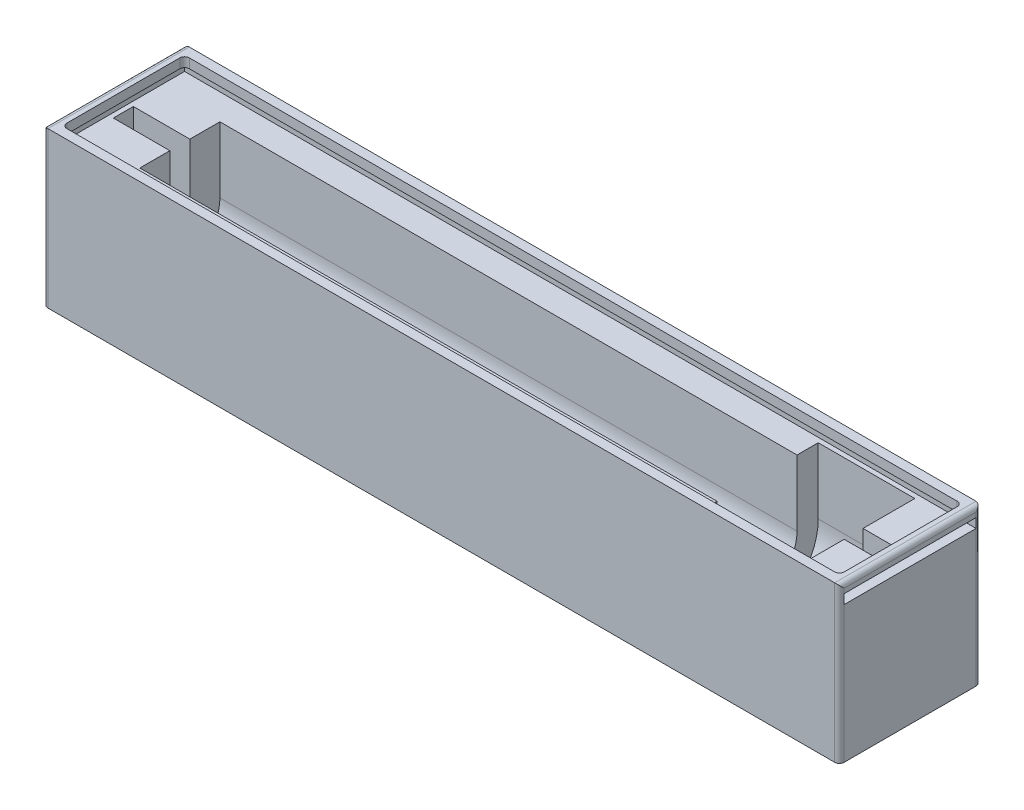
from build123d import *

# Parameters (mm, degrees)
BOSS_EXTRUDE1_DEPTH = 165
SKETCH3_W           = 30
SKETCH3_H           = 32
BOSS_EXTRUDE2_DEPTH = 2
SKETCH4_W           = 30
SKETCH4_H           = 32
BOSS_EXTRUDE3_DEPTH = 2
BOSS_EXTRUDE4_START = 10
BOSS_EXTRUDE4_DEPTH = 10
CUT_EXTRUDE1_DEPTH  = 10
BOSS_EXTRUDE6_DEPTH = 15
CUT_EXTRUDE2_DEPTH  = 15
BOSS_EXTRUDE7_DEPTH = 121
CUT_EXTRUDE3_DEPTH  = 121
SKETCH13_W          = 169
SKETCH13_H          = 30
CUT_EXTRUDE5_DEPTH  = 3
SKETCH14_W          = 169
SKETCH14_H          = 30
BOSS_EXTRUDE8_DEPTH = 3
SKETCH12_W          = 28
SKETCH12_H          = 2
CUT_EXTRUDE6_DEPTH  = 168
SKETCH16_W          = 165
SKETCH16_H          = 26
CUT_EXTRUDE7_DEPTH  = 3
CUT_EXTRUDE8_DEPTH  = 1.5
CUT_EXTRUDE9_DEPTH  = 3
SKETCH20_W          = 169
SKETCH20_H          = 30
BOSS_EXTRUDE9_DEPTH = 1
SKETCH21_W          = 165
SKETCH21_H          = 26
CUT_EXTRUDE10_DEPTH = 1
FILLET1_START       = -16
FILLET1_DEPTH       = 35
FILLET1_2_DEPTH     = 32
FILLET2_R           = 1
CUT_EXTRUDE11_DEPTH = 12


with BuildPart() as part:
    # Sketch2 → Boss-Extrude1 (new body)
    with BuildSketch(Plane(origin=(0, 0, 0), x_dir=(0, 0, -1), z_dir=(1, 0, 0))):
        with BuildLine():
            Line((-13, 0), (-13, 17))
            Line((-13, 17), (-15, 17))
            Line((-15, 17), (-15, -15))
            Line((-15, -15), (15, -15))
            Line((15, -15), (15, 17))
            Line((15, 17), (13, 17))
            Line((13, 17), (13, 0))
            ThreePointArc((13, 0), (0, -13), (-13, 0))
        make_face()
    extrude(amount=BOSS_EXTRUDE1_DEPTH)

    # Sketch3 → Boss-Extrude2 (add)
    with BuildSketch(Plane(origin=(165, 0, 0), x_dir=(0, 0, -1), z_dir=(1, 0, 0))):
        with Locations((0, 1)):
            Rectangle(SKETCH3_W, SKETCH3_H)
    extrude(amount=BOSS_EXTRUDE2_DEPTH)

    # Sketch4 → Boss-Extrude3 (add)
    with BuildSketch(Plane.ZY):
        with Locations((0, 1)):
            Rectangle(SKETCH4_W, SKETCH4_H)
    extrude(amount=BOSS_EXTRUDE3_DEPTH)

    # Sketch5 → Boss-Extrude4 (add)
    with BuildSketch(Plane.ZY.offset(-165).offset(BOSS_EXTRUDE4_START)):
        with BuildLine():
            Line((-13, 17), (-13, 0))
            ThreePointArc((-13, 0), (0, -13), (13, 0))
            Line((13, 0), (13, 17))
            Line((13, 17), (-13, 17))
        make_face()
    extrude(amount=-BOSS_EXTRUDE4_DEPTH)

    # Sketch6 → Cut-Extrude1 (cut)
    with BuildSketch(Plane.ZY.offset(-155)):
        with BuildLine():
            Line((-2, 0), (-2, 17))
            Line((-2, 17), (2, 17))
            Line((2, 17), (2, 0))
            ThreePointArc((2, 0), (0, -2), (-2, 0))
        make_face()
    extrude(amount=-CUT_EXTRUDE1_DEPTH, mode=Mode.SUBTRACT)

    # Sketch8 → Boss-Extrude6 (add)
    with BuildSketch(Plane(origin=(0, 0, 0), x_dir=(0, 0, -1), z_dir=(1, 0, 0))):
        with BuildLine():
            Line((13, 0), (13, 17))
            Line((13, 17), (-13, 17))
            Line((-13, 17), (-13, 0))
            ThreePointArc((-13, 0), (0, -13), (13, 0))
        make_face()
    extrude(amount=BOSS_EXTRUDE6_DEPTH)

    # Sketch9 → Cut-Extrude2 (cut)
    with BuildSketch(Plane(origin=(15, 0, 0), x_dir=(0, 0, -1), z_dir=(1, 0, 0))):
        with BuildLine():
            Line((-2.125, 0), (-2.125, 17))
            Line((-2.125, 17), (2.125, 17))
            Line((2.125, 17), (2.125, 0))
            ThreePointArc((2.125, 0), (0, -2.125), (-2.125, 0))
        make_face()
    extrude(amount=-CUT_EXTRUDE2_DEPTH, mode=Mode.SUBTRACT)

    # Sketch10 → Boss-Extrude7 (add)
    with BuildSketch(Plane(origin=(15, 0, 0), x_dir=(0, 0, -1), z_dir=(1, 0, 0))):
        with BuildLine():
            Line((13, 0), (13, 17))
            Line((13, 17), (-13, 17))
            Line((-13, 17), (-13, 0))
            ThreePointArc((-13, 0), (0, -13), (13, 0))
        make_face()
    extrude(amount=BOSS_EXTRUDE7_DEPTH)

    # Sketch11 → Cut-Extrude3 (cut)
    with BuildSketch(Plane(origin=(136, 0, 0), x_dir=(0, 0, -1), z_dir=(1, 0, 0))):
        with BuildLine():
            Line((-8.5, 0), (-8.5, 17))
            Line((-8.5, 17), (8.5, 17))
            Line((8.5, 17), (8.5, 0))
            ThreePointArc((8.5, 0), (0, -8.5), (-8.5, 0))
        make_face()
    extrude(amount=-CUT_EXTRUDE3_DEPTH, mode=Mode.SUBTRACT)

    # Sketch13 → Cut-Extrude5 (cut)
    with BuildSketch(Plane(origin=(0, 17, 0), x_dir=(1, 0, 0), z_dir=(0, 1, 0))):
        with Locations((82.5, 0)):
            Rectangle(SKETCH13_W, SKETCH13_H)
    extrude(amount=-CUT_EXTRUDE5_DEPTH, mode=Mode.SUBTRACT)

    # Sketch14 → Boss-Extrude8 (add)
    with BuildSketch(Plane(origin=(0, 14, 0), x_dir=(1, 0, 0), z_dir=(0, 1, 0))):
        with Locations((82.5, 0)):
            Rectangle(SKETCH14_W, SKETCH14_H)
    extrude(amount=BOSS_EXTRUDE8_DEPTH)

    # Sketch12 → Cut-Extrude6 (cut)
    with BuildSketch(Plane(origin=(167, 0, 0), x_dir=(0, 0, -1), z_dir=(1, 0, 0))):
        with Locations((0, 15)):
            Rectangle(SKETCH12_W, SKETCH12_H)
    extrude(amount=-CUT_EXTRUDE6_DEPTH, mode=Mode.SUBTRACT)

    # Sketch16 → Cut-Extrude7 (cut)
    with BuildSketch(Plane(origin=(0, 17, 0), x_dir=(1, 0, 0), z_dir=(0, 1, 0))):
        with Locations((82.5, 0)):
            Rectangle(SKETCH16_W, SKETCH16_H)
    extrude(amount=-CUT_EXTRUDE7_DEPTH, mode=Mode.SUBTRACT)

    # Sketch17 → Cut-Extrude8 (cut)
    with BuildSketch(Plane(origin=(136, 0, 0), x_dir=(0, 0, -1), z_dir=(1, 0, 0))):
        with BuildLine():
            Line((13, 14), (13, 0))
            ThreePointArc((13, 0), (0, -13), (-13, 0))
            Line((-13, 0), (-13, 14))
            Line((-13, 14), (-8.5, 14))
            Line((-8.5, 14), (-8.5, 0))
            ThreePointArc((-8.5, 0), (0, -8.5), (8.5, 0))
            Line((8.5, 0), (8.5, 14))
            Line((8.5, 14), (13, 14))
        make_face()
    extrude(amount=-CUT_EXTRUDE8_DEPTH, mode=Mode.SUBTRACT)

    # Sketch18 → Cut-Extrude9 (cut)
    with BuildSketch(Plane(origin=(15, 0, 0), x_dir=(0, 0, -1), z_dir=(1, 0, 0))):
        with BuildLine():
            Line((8.5, 0), (8.5, 14))
            Line((8.5, 14), (2.125, 14))
            Line((2.125, 14), (2.125, 0))
            ThreePointArc((2.125, 0), (0, -2.125), (-2.125, 0))
            Line((-2.125, 0), (-2.125, 14))
            Line((-2.125, 14), (-8.5, 14))
            Line((-8.5, 14), (-8.5, 0))
            ThreePointArc((-8.5, 0), (0, -8.5), (8.5, 0))
        make_face()
    extrude(amount=-CUT_EXTRUDE9_DEPTH, mode=Mode.SUBTRACT)

    # Sketch20 → Boss-Extrude9 (add)
    with BuildSketch(Plane(origin=(0, 17, 0), x_dir=(1, 0, 0), z_dir=(0, 1, 0))):
        with Locations((82.5, 0)):
            Rectangle(SKETCH20_W, SKETCH20_H)
    extrude(amount=BOSS_EXTRUDE9_DEPTH)

    # Sketch21 → Cut-Extrude10 (cut)
    with BuildSketch(Plane(origin=(0, 18, 0), x_dir=(1, 0, 0), z_dir=(0, 1, 0))):
        with Locations((82.5, 0)):
            Rectangle(SKETCH21_W, SKETCH21_H)
    extrude(amount=-CUT_EXTRUDE10_DEPTH, mode=Mode.SUBTRACT)

    # Fillet1: read off the stored shape, not the designer's step
    # Fillet1 outline → Fillet1 (cut)
    with BuildSketch(Plane(origin=(0, 0, 0), x_dir=(1, 0, 0), z_dir=(0, 1, 0)).offset(FILLET1_START)):
        with BuildLine():
            Line((-2, 15), (-2, 14))
            ThreePointArc((-2, 14), (-1.707106781, 14.707106781), (-1, 15))
            Line((-1, 15), (-2, 15))
        make_face()
        with BuildLine():
            ThreePointArc((-1, -15), (-1.707106781, -14.707106781), (-2, -14))
            Line((-2, -14), (-2, -15))
            Line((-2, -15), (-1, -15))
        make_face()
        with BuildLine():
            Line((167, 15), (166, 15))
            ThreePointArc((166, 15), (166.707106781, 14.707106781), (167, 14))
            Line((167, 14), (167, 15))
        make_face()
        with BuildLine():
            ThreePointArc((167, -14), (166.707106781, -14.707106781), (166, -15))
            Line((166, -15), (167, -15))
            Line((167, -15), (167, -14))
        make_face()
    extrude(amount=FILLET1_DEPTH, mode=Mode.SUBTRACT)

    # Fillet1 2 outline → Fillet1 2 (cut)
    with BuildSketch(Plane.XY.offset(FILLET1_START)):
        with BuildLine():
            Line((167, 18), (166, 18))
            ThreePointArc((166, 18), (166.707106781, 17.707106781), (167, 17))
            Line((167, 17), (167, 18))
        make_face()
        with BuildLine():
            ThreePointArc((-2, 17), (-1.707106781, 17.707106781), (-1, 18))
            Line((-1, 18), (-2, 18))
            Line((-2, 18), (-2, 17))
        make_face()
    extrude(amount=FILLET1_2_DEPTH, mode=Mode.SUBTRACT)

    # Fillet2
    fillet2_edges = [part.edges().sort_by_distance(p)[0] for p in [
        (0, 17, 13),
        (0, 17, -13),
        (165, 17, -13),
        (165, 17, 13),
    ]]
    fillet(fillet2_edges, radius=FILLET2_R)

    # Sketch22 → Cut-Extrude11 (cut)
    with BuildSketch(Plane(origin=(12, 0, 0), x_dir=(0, 0, -1), z_dir=(1, 0, 0))):
        with BuildLine():
            Line((-2.125, 0), (-2.125, -8.230089611))
            ThreePointArc((-2.125, -8.230089611), (0, -8.5), (2.125, -8.230089611))
            Line((2.125, -8.230089611), (2.125, 0))
            ThreePointArc((2.125, 0), (0, -2.125), (-2.125, 0))
        make_face()
    extrude(amount=-CUT_EXTRUDE11_DEPTH, mode=Mode.SUBTRACT)


solid = part.part
